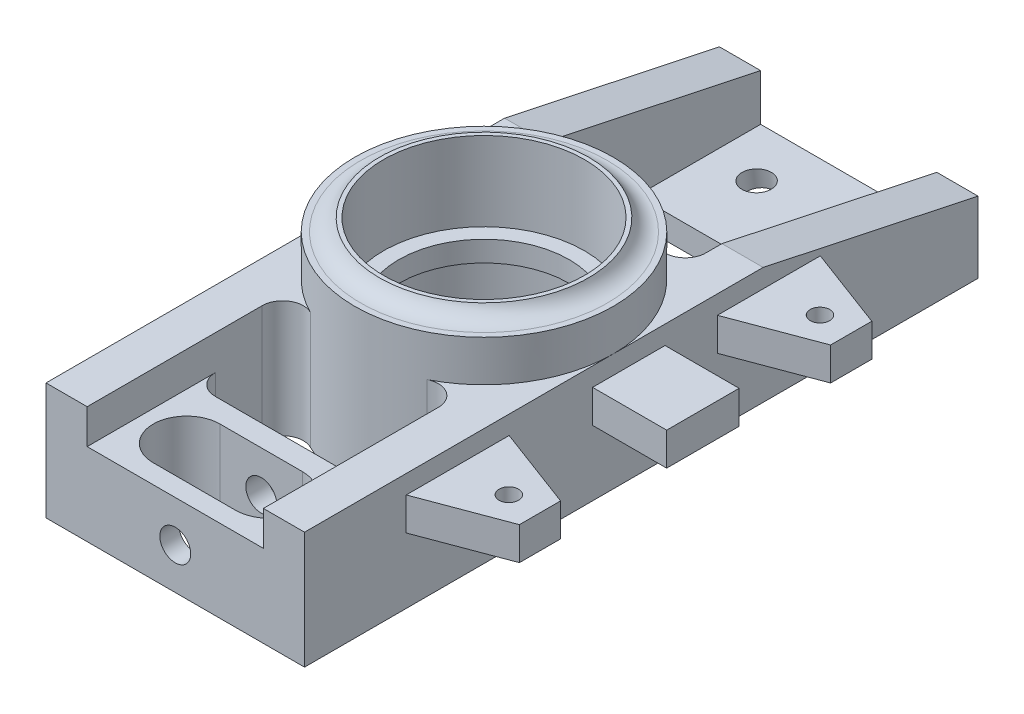
from build123d import *
from build123d.topology import SkipClean

# Parameters (mm, degrees)
HOUSING_FILLET_LIP_R               = 6.35
UBJ_START                          = 36.068
UBJ_MATERIAL_PREP_DEPTH            = 36.068
UBJ_FLAT_CAMBER_SPOT_DEPTH         = 28.448
WEIGHT_SAVING_UPPER_CUT_REACH      = 129.564
WEIGHT_SAVE_ARM_SHORT_REACH        = 149.603
UBJ_FILLET_R                       = 6.35
UBJ_HOLES_REACH                    = 137.735
UBJ_HOLE_SKETCH_R                  = 4.5
SKETCH18_R                         = 8
CUT_EXTRUDE2_DEPTH                 = 3.81
LBJ_START                          = -36.068
LBJ_MATERIAL_PREP_DEPTH            = 36.068
FLAT_LBJ_PREP_DEPTH                = 10.668
LBJ_SLOT_DEPTH                     = 25.4
LBJ_WEIGHT_AND_BOLT_CLEARING_DEPTH = 25.4
LBJ_FILLET_R                       = 6.35
LBJ_HOLE_REACH                     = 220
SKETCH14_R                         = 4.7625
BRAKE_HOLER_R                      = 3
BRAKE_CALIPER_HOLER_DEPTH          = 10.16
SKETCH16_W                         = 22.86
SKETCH16_H                         = 22.352
SPEED_SENSOR_EXTRUDE_DEPTH         = 10.16
SKETCH19_R                         = 1.27
TOE_BRAKCET_HOLES_DEPTH            = 9
THREAD1_PITCH                      = 0.79375
THREAD2_PITCH                      = 0.79375
THREAD3_PITCH                      = 0.79375


with BuildPart() as part:
    # Bearing Sketch → Bearing Revolve (revolve)
    with BuildSketch(Plane(origin=(0, 0, 0), x_dir=(0, 0, -1), z_dir=(1, 0, 0)), mode=Mode.PRIVATE) as bearing_revolve_sk:
        Polygon((-39.878, 0), (-39.878, 48.768), (-32.258, 48.768), (-32.258, 52.578), (-30.99943, 52.578), (-30.99943, 28.194), (-26.289, 28.194), (-26.289, 21.844), (-30.99943, 21.844), (-30.99943, 0), align=None)
    revolve(bearing_revolve_sk.sketch.rotate(Axis((0, 0, 0), (0, 1, 0)), 180), axis=Axis((0, 0, 0), (0, 1, 0)))

    # Housing Fillet Lip
    # the kernel refuses this fillet: 6.35 mm, written as the material it adds along each edge
    with BuildSketch(Plane(origin=(0, 48.768, 0), x_dir=(0, 0, -1), z_dir=(1, 0, 0))) as housing_fillet_lip_piece_1:
        with BuildLine():
            CenterArc((38.077871133, 6.35), HOUSING_FILLET_LIP_R, 203.578178478, 66.421821522)
            Line((32.258, 3.81), (32.141602577, 3.7592))
            ThreePointArc((32.141602577, 3.7592), (32.131, 1.905), (32.131, 0))
            Line((32.131, 0), (32.258, -0.127))
            Line((32.258, -0.127), (38.077871133, -0.127))
            Line((38.077871133, -0.127), (38.077871133, 0))
        make_face()
    revolve(axis=Axis((0, 48.768, 0), (0, 1, 0)))

    # PrepArea(WithadjWidth) → UBJ Material Prep (add)
    with BuildSketch(Plane(origin=(0, 0, 0), x_dir=(1, 0, 0), z_dir=(0, 1, 0)).offset(UBJ_START)):
        with BuildLine():
            Line((-39.878, 0), (-39.878, 112.522))
            Line((-39.878, 112.522), (39.878, 112.522))
            Line((39.878, 112.522), (39.878, 0))
            ThreePointArc((39.878, 0), (0, 39.878), (-39.878, 0))
        make_face()
    extrude(amount=-UBJ_MATERIAL_PREP_DEPTH)

    # Flat Camber Spot → UBJ Flat Camber Spot (cut)
    with SkipClean():  # the faces are left unmerged after this step: merging them gives an invalid solid
        with BuildSketch(Plane(origin=(0, 36.068, 0), x_dir=(1, 0, 0), z_dir=(0, 1, 0))):
            with BuildLine():
                Line((-27.178, 112.522), (-27.178, 29.182378244))
                ThreePointArc((-27.178, 29.182378244), (0, 39.878), (27.178, 29.182378244))
                Line((27.178, 29.182378244), (27.178, 112.522))
                Line((27.178, 112.522), (-27.178, 112.522))
            make_face()
        extrude(amount=-UBJ_FLAT_CAMBER_SPOT_DEPTH, mode=Mode.SUBTRACT)
    add(part.part.scale(1), mode=Mode.REPLACE)  # the faces are merged on a copy

    # WeightUpper Cut → Weight Saving Upper Cut (cut, up to next)
    with BuildSketch(Plane(origin=(0, 7.62, 0), x_dir=(1, 0, 0), z_dir=(0, 1, 0)), mode=Mode.PRIVATE) as weight_saving_upper_cut_sk1:
        with BuildLine():
            Line((-27.178, 74.422), (27.178, 74.422))
            Line((27.178, 74.422), (27.178, 29.182378244))
            ThreePointArc((27.178, 29.182378244), (0, 39.878), (-27.178, 29.182378244))
            Line((-27.178, 29.182378244), (-27.178, 74.422))
        make_face()
    weight_saving_upper_cut_tool1 = extrude(weight_saving_upper_cut_sk1.sketch, amount=-WEIGHT_SAVING_UPPER_CUT_REACH, mode=Mode.PRIVATE) & part.part
    add(weight_saving_upper_cut_tool1.solids().sort_by_distance((0, 7.62, -55.347878))[0], mode=Mode.SUBTRACT)

    # Weight Save Arm Short: up to this face of the body (flat: up to its plane)
    weight_save_arm_short_end = Plane(part.part.faces().sort_by_distance((39.878, 18.034, -56.261))[0])
    # Sketch8 → Weight Save Arm Short (cut, up to the picked face)
    with BuildSketch(Plane.ZY.offset(39.878), mode=Mode.PRIVATE) as weight_save_arm_short_sk1:
        Polygon((-112.522, 21.976775301), (-46.228, 36.068), (-112.522, 36.068), align=None)
    weight_save_arm_short_tool1 = split(extrude(weight_save_arm_short_sk1.sketch, amount=-WEIGHT_SAVE_ARM_SHORT_REACH, mode=Mode.PRIVATE), bisect_by=weight_save_arm_short_end, keep=Keep.BOTH, mode=Mode.PRIVATE)
    add(weight_save_arm_short_tool1.solids().sort_by(Axis((-39.878, 31.370925, -90.424), (1, 0, 0)))[0], mode=Mode.SUBTRACT)

    # UBJ Fillet
    # the kernel refuses this fillet: 6.35 mm, written as the material it adds along each edge
    with BuildSketch(Plane(origin=(27.178, 36.068, -29.182378244), x_dir=(-0.8204405839916293, 0, -0.5717317973835933), z_dir=(0, -1, 0))) as ubj_fillet_piece_1:
        with BuildLine():
            CenterArc((12.120741225, 6.286772968), UBJ_FILLET_R, 145.128922247, 116.778941593)
            Line((6.910943516, 9.917269881), (0, 0))
            ThreePointArc((0, 0), (5.613440626, 0.397065762), (11.226881252, 0))
        make_face()
    extrude(amount=28.448)
    with BuildSketch(Plane(origin=(-27.178, 36.068, -29.182378244), x_dir=(0.8204405839916296, 0, -0.5717317973835931), z_dir=(0, -1, 0))) as ubj_fillet_piece_2:
        with BuildLine():
            CenterArc((12.120741225, -6.286772968), UBJ_FILLET_R, 98.09213616, 116.778941593)
            Line((6.910943516, -9.917269881), (0, 0))
            ThreePointArc((0, 0), (5.613440626, -0.397065762), (11.226881252, 0))
        make_face()
    extrude(amount=28.448)
    with BuildSketch(Plane(origin=(-27.178, 7.62, -74.422), x_dir=(0, 0, 1), z_dir=(0, -1, 0)), Plane(origin=(27.178, 7.62, -74.422), x_dir=(-1, 0, 0), z_dir=(0, -1, 0))) as ubj_fillet_piece_3:
        with BuildLine():
            CenterArc((UBJ_FILLET_R, -UBJ_FILLET_R), UBJ_FILLET_R, 90, 90)
            Line((0, -UBJ_FILLET_R), (0, 0))
            Line((0, 0), (UBJ_FILLET_R, 0))
        make_face()
    extrude(amount=7.62)
    with BuildSketch(Plane(origin=(-27.178, 7.62, -29.182378244), x_dir=(0.8204405839916296, 0, -0.5717317973835931), z_dir=(0, -1, 0))) as ubj_fillet_piece_4:
        with BuildLine():
            CenterArc((12.120741225, -6.286772968), UBJ_FILLET_R, 98.09213616, 116.778941593)
            Line((6.910943516, -9.917269881), (0, 0))
            ThreePointArc((0, 0), (5.613440626, -0.397065762), (11.226881252, 0))
        make_face()
    extrude(amount=7.62)
    with BuildSketch(Plane(origin=(27.178, 7.62, -29.182378244), x_dir=(-0.8204405839916293, 0, -0.5717317973835934), z_dir=(0, -1, 0))) as ubj_fillet_piece_5:
        with BuildLine():
            CenterArc((12.120741225, 6.286772968), UBJ_FILLET_R, 145.128922247, 116.778941593)
            Line((6.910943516, 9.917269881), (0, 0))
            ThreePointArc((0, 0), (5.613440626, 0.397065762), (11.226881252, 0))
        make_face()
    extrude(amount=7.62)

    # UBJ Holes: up to this plane
    ubj_holes_end = Plane(origin=(0, 7.62, 30.99943), z_dir=(0, 1, 0))
    # UBJ Hole Sketch → UBJ Holes (cut, up to the surface)
    with BuildSketch(Plane(origin=(0, -15.81854211, -2.269576176), x_dir=(-1, 0, 0), z_dir=(0, -0.9898635935888408, -0.1420213578564376)), mode=Mode.PRIVATE) as ubj_holes_sk1:
        with Locations(Location((-12.7, 96.903431278, 0), (0, 0, 90))):
            Circle(UBJ_HOLE_SKETCH_R)
    ubj_holes_tool1 = split(extrude(ubj_holes_sk1.sketch, amount=-UBJ_HOLES_REACH, mode=Mode.PRIVATE), bisect_by=ubj_holes_end, keep=Keep.BOTH, mode=Mode.PRIVATE)
    add(ubj_holes_tool1.solids().sort_by_distance((12.7, -2.056185, -98.190755))[0], mode=Mode.SUBTRACT)
    # UBJ Hole Sketch → UBJ Holes (cut, up to the surface)
    with BuildSketch(Plane(origin=(0, -15.81854211, -2.269576176), x_dir=(-1, 0, 0), z_dir=(0, -0.9898635935888408, -0.1420213578564376)), mode=Mode.PRIVATE) as ubj_holes_sk2:
        with Locations(Location((12.7, 96.903431278, 0), (0, 0, 90))):
            Circle(UBJ_HOLE_SKETCH_R)
    ubj_holes_tool2 = split(extrude(ubj_holes_sk2.sketch, amount=-UBJ_HOLES_REACH, mode=Mode.PRIVATE), bisect_by=ubj_holes_end, keep=Keep.BOTH, mode=Mode.PRIVATE)
    add(ubj_holes_tool2.solids().sort_by_distance((-12.7, -2.056185, -98.190755))[0], mode=Mode.SUBTRACT)

    # Sketch18 → Cut-Extrude2 (cut)
    with BuildSketch(Plane(origin=(0, -15.81854211, -2.269576176), x_dir=(-1, 0, 0), z_dir=(0, -0.9898635935888408, -0.1420213578564376))):
        with Locations(Location((-12.7, 96.903431278, 0), (0, 0, 90))):
            Circle(SKETCH18_R)
        with Locations(Location((12.7, 96.903431278, 0), (0, 0, 90))):
            Circle(SKETCH18_R)
    extrude(amount=-CUT_EXTRUDE2_DEPTH, mode=Mode.SUBTRACT)

    # Sketch9 → LBJ Material Prep (add)
    with BuildSketch(Plane.XZ.offset(LBJ_START)):
        with BuildLine():
            Line((-39.878, 0), (-39.878, 95.25))
            Line((-39.878, 95.25), (39.878, 95.25))
            Line((39.878, 95.25), (39.878, 0))
            ThreePointArc((39.878, 0), (0, 39.878), (-39.878, 0))
        make_face()
    extrude(amount=LBJ_MATERIAL_PREP_DEPTH)

    # Sketch10 → Flat LBJ Prep (cut)
    with SkipClean():  # the faces are left unmerged after this step: merging them gives an invalid solid
        with BuildSketch(Plane(origin=(0, 36.068, 0), x_dir=(1, 0, 0), z_dir=(0, 1, 0))):
            with BuildLine():
                Line((-27.178, -29.182378244), (-27.178, -95.25))
                Line((-27.178, -95.25), (27.178, -95.25))
                Line((27.178, -95.25), (27.178, -29.182378244))
                ThreePointArc((27.178, -29.182378244), (0, -39.878), (-27.178, -29.182378244))
            make_face()
        extrude(amount=-FLAT_LBJ_PREP_DEPTH, mode=Mode.SUBTRACT)

    # Sketch12 → LBJ Slot (cut)
    with SkipClean():  # the faces are left unmerged after this step: merging them gives an invalid solid
        with BuildSketch(Plane(origin=(0, 25.4, 0), x_dir=(1, 0, 0), z_dir=(0, 1, 0))):
            with BuildLine():
                Line((-12.7, -68.717839434), (12.7, -68.717839434))
                ThreePointArc((12.7, -68.717839434), (23.0251, -79.042939434), (12.7, -89.368039434))
                Line((12.7, -89.368039434), (-12.7, -89.368039434))
                ThreePointArc((-12.7, -89.368039434), (-23.0251, -79.042939434), (-12.7, -68.717839434))
            make_face()
        extrude(amount=-LBJ_SLOT_DEPTH, mode=Mode.SUBTRACT)

    # Sketch13 → LBJ Weight and Bolt Clearing (cut)
    with SkipClean():  # the faces are left unmerged after this step: merging them gives an invalid solid
        with BuildSketch(Plane(origin=(0, 25.4, 0), x_dir=(1, 0, 0), z_dir=(0, 1, 0))):
            with BuildLine():
                Line((-27.178, -29.182378244), (-27.178, -62.075739434))
                Line((-27.178, -62.075739434), (27.178, -62.075739434))
                Line((27.178, -62.075739434), (27.178, -29.182378244))
                ThreePointArc((27.178, -29.182378244), (0, -39.878), (-27.178, -29.182378244))
            make_face()
        extrude(amount=-LBJ_WEIGHT_AND_BOLT_CLEARING_DEPTH, mode=Mode.SUBTRACT)

    # LBJ Fillet
    # the kernel refuses this fillet: 6.35 mm, written as the material it adds along each edge
    with BuildSketch(Plane(origin=(-27.178, 25.4, 29.182378244), x_dir=(0.8204405839916299, 0, 0.5717317973835926), z_dir=(0, -1, 0))) as lbj_fillet_piece_1:
        with BuildLine():
            CenterArc((12.120741225, 6.286772968), LBJ_FILLET_R, 145.128922247, 116.778941593)
            Line((6.910943516, 9.917269881), (0, 0))
            ThreePointArc((0, 0), (5.613440626, 0.397065762), (11.226881252, 0))
        make_face()
    extrude(amount=25.4)
    with BuildSketch(Plane(origin=(27.178, 25.4, 29.182378244), x_dir=(-0.8204405839916303, 0, 0.5717317973835919), z_dir=(0, -1, 0))) as lbj_fillet_piece_2:
        with BuildLine():
            CenterArc((12.120741225, -6.286772968), LBJ_FILLET_R, 98.09213616, 116.778941593)
            Line((6.910943516, -9.917269881), (0, 0))
            ThreePointArc((0, 0), (5.613440626, -0.397065762), (11.226881252, 0))
        make_face()
    extrude(amount=25.4)
    with BuildSketch(Plane(origin=(27.178, 25.4, 62.075739434), x_dir=(-1, 0, 0), z_dir=(0, -1, 0)), Plane(origin=(-27.178, 25.4, 62.075739434), x_dir=(0, 0, -1), z_dir=(0, -1, 0))) as lbj_fillet_piece_3:
        with BuildLine():
            CenterArc((LBJ_FILLET_R, LBJ_FILLET_R), LBJ_FILLET_R, 180, 90)
            Line((0, LBJ_FILLET_R), (0, 0))
            Line((0, 0), (LBJ_FILLET_R, 0))
        make_face()
    extrude(amount=25.4)
    with BuildSketch(Plane(origin=(27.178, 36.068, 29.182378244), x_dir=(-0.8204405839916302, 0, 0.571731797383592), z_dir=(0, -1, 0))) as lbj_fillet_piece_4:
        with BuildLine():
            CenterArc((12.120741225, -6.286772968), LBJ_FILLET_R, 98.09213616, 116.778941593)
            Line((6.910943516, -9.917269881), (0, 0))
            ThreePointArc((0, 0), (5.613440626, -0.397065762), (11.226881252, 0))
        make_face()
    extrude(amount=10.668)
    with BuildSketch(Plane(origin=(-27.178, 36.068, 29.182378244), x_dir=(0.8204405839916299, 0, 0.5717317973835926), z_dir=(0, -1, 0))) as lbj_fillet_piece_5:
        with BuildLine():
            CenterArc((12.120741225, 6.286772968), LBJ_FILLET_R, 145.128922247, 116.778941593)
            Line((6.910943516, 9.917269881), (0, 0))
            ThreePointArc((0, 0), (5.613440626, 0.397065762), (11.226881252, 0))
        make_face()
    extrude(amount=10.668)

    # LBJ Hole: up to this face of the body (flat: up to its plane)
    lbj_hole_end = Plane(part.part.faces().sort_by_distance((0, 12.7, 62.075739434))[0])
    # Sketch14 → LBJ Hole (cut, up to the picked face)
    with BuildSketch(Plane.XY.offset(95.25), mode=Mode.PRIVATE) as lbj_hole_sk1:
        with Locations((0, 12.7)):
            Circle(SKETCH14_R)
    lbj_hole_tool1 = split(extrude(lbj_hole_sk1.sketch, amount=-LBJ_HOLE_REACH, mode=Mode.PRIVATE), bisect_by=lbj_hole_end, keep=Keep.BOTH, mode=Mode.PRIVATE)
    add(lbj_hole_tool1.solids().sort_by(Axis((0, 12.7, 95.25), (0, 0, -1)))[0], mode=Mode.SUBTRACT)

    # Brake Holer → Brake Caliper Holer (add)
    # profile 1 of 2: a face of its own
    with BuildSketch(Plane(origin=(0, 20.17, 0), x_dir=(-1, 0, 0), z_dir=(0, -1, 0))):
        Polygon((-39.878, -32.125), (-65.278, -41.65), (-65.278, -54.35), (-39.878, -63.875), align=None)
        with Locations(Location((-55.6468, -48, 0), (0, 0, 90))):
            Circle(BRAKE_HOLER_R, mode=Mode.SUBTRACT)
    # profile 2 of 2: a face of its own
    with BuildSketch(Plane(origin=(0, 20.17, 0), x_dir=(-1, 0, 0), z_dir=(0, -1, 0))):
        Polygon((-39.878, 32.125), (-39.878, 63.875), (-65.278, 54.35), (-65.278, 41.65), align=None)
        with Locations(Location((-55.6468, 48, 0), (0, 0, 90))):
            Circle(BRAKE_HOLER_R, mode=Mode.SUBTRACT)
    extrude(amount=-BRAKE_CALIPER_HOLER_DEPTH)

    # Sketch16 → Speed Sensor Extrude (add)
    with BuildSketch(Plane(origin=(0, 20.17, 0), x_dir=(-1, 0, 0), z_dir=(0, -1, 0))):
        with Locations((-51.308, 4.791359774)):
            Rectangle(SKETCH16_W, SKETCH16_H)
    extrude(amount=-SPEED_SENSOR_EXTRUDE_DEPTH)

    # Sketch19 → Toe Brakcet Holes (cut)
    with BuildSketch(Plane.ZY.offset(39.878)):
        with Locations((31.2928, 26.67)):
            Circle(SKETCH19_R)
        with Locations((31.2928, 9.525)):
            Circle(SKETCH19_R)
        with Locations((55.1053, 9.525)):
            Circle(SKETCH19_R)
    extrude(amount=-TOE_BRAKCET_HOLES_DEPTH, mode=Mode.SUBTRACT)

    # Thread1: the profile of Thread Profile1 profile screwed along a right-hand helix of 12.598425 turns, 8 arcs to a turn; built about Z, then put on its axis
    with SkipClean():  # the faces are left unmerged after this step: merging them gives an invalid solid
        thread1_z = Axis((0, 0, 0), (0, 0, 1))
        thread1_corners = [(1.2697, 0, -0.000173205), (1.699629788, 0, 0.248046874), (1.699629788, 0, 0.347265624), (1.2697, 0, 0.595485703)]
        with BuildLine(mode=Mode.PRIVATE) as thread1_profile:
            Line(thread1_corners[0], thread1_corners[1])
            Line(thread1_corners[1], thread1_corners[2])
            Line(thread1_corners[2], thread1_corners[3])
            Line(thread1_corners[3], thread1_corners[0])
        thread1_cap = Face(thread1_profile.wire())
        thread1_turn_angles = [0, 22.5, 45, 67.5, 90, 112.5, 135, 157.5, 180, 202.5, 225, 247.5, 270, 292.5, 315, 337.5, 360]
        thread1_turn_weights = [1, 0.9238795325112867, 1, 0.9238795325112867, 1, 0.9238795325112867, 1, 0.9238795325112867, 1, 0.9238795325112867, 1, 0.9238795325112867, 1, 0.9238795325112867, 1, 0.9238795325112867, 1]
        thread1_turn_rails = [Edge.make_bspline([Vector(p[0], p[1], 0).rotate(thread1_z, thread1_turn_angles[k]) / thread1_turn_weights[k] + Vector(0, 0, p[2] + THREAD1_PITCH * thread1_turn_angles[k] / 360) for k in range(17)], [0, 0, 0, 1, 1, 2, 2, 3, 3, 4, 4, 5, 5, 6, 6, 7, 7, 8, 8, 8], 2, thread1_turn_weights) for p in thread1_corners]
        thread1_turn_sides = [Face.make_surface_from_curves(thread1_turn_rails[p[0]], thread1_turn_rails[p[1]]) for p in [(0, 1), (1, 2), (2, 3), (3, 0)]]
        thread1_last_angles = [4320, 4342.5, 4365, 4387.5, 4410, 4432.5, 4455, 4477.5, 4500, 4517.716535433, 4535.433070866]
        thread1_last_weights = [1, 0.9238795325112867, 1, 0.9238795325112867, 1, 0.9238795325112867, 1, 0.9238795325112867, 1, 0.9525736983244454, 1]
        thread1_last_rails = [Edge.make_bspline([Vector(p[0], p[1], 0).rotate(thread1_z, thread1_last_angles[k]) / thread1_last_weights[k] + Vector(0, 0, p[2] + THREAD1_PITCH * thread1_last_angles[k] / 360) for k in range(11)], [0, 0, 0, 1, 1, 2, 2, 3, 3, 4, 4, 5, 5, 5], 2, thread1_last_weights) for p in thread1_corners]
        thread1_last_sides = [Face.make_surface_from_curves(thread1_last_rails[p[0]], thread1_last_rails[p[1]]) for p in [(0, 1), (1, 2), (2, 3), (3, 0)]]
        thread1 = Plane(origin=(-39.878, 26.67, 31.2928), x_dir=(0, 0, -1), z_dir=(1, 0, 0)) * Solid(Shell([*[p.moved(Location((0, 0, THREAD1_PITCH * i))) for i in range(12) for p in thread1_turn_sides], *thread1_last_sides, thread1_cap, thread1_cap.rotate(thread1_z, 4535.433070866).moved(Location((0, 0, THREAD1_PITCH * 4535.433070866 / 360)))]))
        add(thread1, mode=Mode.SUBTRACT)

    # Thread2: the profile of Thread Profile2 profile screwed along a right-hand helix of 12.598425 turns, 8 arcs to a turn; built about Z, then put on its axis
    with SkipClean():  # the faces are left unmerged after this step: merging them gives an invalid solid
        thread2_z = Axis((0, 0, 0), (0, 0, 1))
        thread2_corners = [(1.2697, 0, -0.000173205), (1.699629788, 0, 0.248046874), (1.699629788, 0, 0.347265624), (1.2697, 0, 0.595485703)]
        with BuildLine(mode=Mode.PRIVATE) as thread2_profile:
            Line(thread2_corners[0], thread2_corners[1])
            Line(thread2_corners[1], thread2_corners[2])
            Line(thread2_corners[2], thread2_corners[3])
            Line(thread2_corners[3], thread2_corners[0])
        thread2_cap = Face(thread2_profile.wire())
        thread2_turn_angles = [0, 22.5, 45, 67.5, 90, 112.5, 135, 157.5, 180, 202.5, 225, 247.5, 270, 292.5, 315, 337.5, 360]
        thread2_turn_weights = [1, 0.9238795325112867, 1, 0.9238795325112867, 1, 0.9238795325112867, 1, 0.9238795325112867, 1, 0.9238795325112867, 1, 0.9238795325112867, 1, 0.9238795325112867, 1, 0.9238795325112867, 1]
        thread2_turn_rails = [Edge.make_bspline([Vector(p[0], p[1], 0).rotate(thread2_z, thread2_turn_angles[k]) / thread2_turn_weights[k] + Vector(0, 0, p[2] + THREAD2_PITCH * thread2_turn_angles[k] / 360) for k in range(17)], [0, 0, 0, 1, 1, 2, 2, 3, 3, 4, 4, 5, 5, 6, 6, 7, 7, 8, 8, 8], 2, thread2_turn_weights) for p in thread2_corners]
        thread2_turn_sides = [Face.make_surface_from_curves(thread2_turn_rails[p[0]], thread2_turn_rails[p[1]]) for p in [(0, 1), (1, 2), (2, 3), (3, 0)]]
        thread2_last_angles = [4320, 4342.5, 4365, 4387.5, 4410, 4432.5, 4455, 4477.5, 4500, 4517.716535433, 4535.433070866]
        thread2_last_weights = [1, 0.9238795325112867, 1, 0.9238795325112867, 1, 0.9238795325112867, 1, 0.9238795325112867, 1, 0.9525736983244454, 1]
        thread2_last_rails = [Edge.make_bspline([Vector(p[0], p[1], 0).rotate(thread2_z, thread2_last_angles[k]) / thread2_last_weights[k] + Vector(0, 0, p[2] + THREAD2_PITCH * thread2_last_angles[k] / 360) for k in range(11)], [0, 0, 0, 1, 1, 2, 2, 3, 3, 4, 4, 5, 5, 5], 2, thread2_last_weights) for p in thread2_corners]
        thread2_last_sides = [Face.make_surface_from_curves(thread2_last_rails[p[0]], thread2_last_rails[p[1]]) for p in [(0, 1), (1, 2), (2, 3), (3, 0)]]
        thread2 = Plane(origin=(-39.878, 9.525, 31.2928), x_dir=(0, 0, -1), z_dir=(1, 0, 0)) * Solid(Shell([*[p.moved(Location((0, 0, THREAD2_PITCH * i))) for i in range(12) for p in thread2_turn_sides], *thread2_last_sides, thread2_cap, thread2_cap.rotate(thread2_z, 4535.433070866).moved(Location((0, 0, THREAD2_PITCH * 4535.433070866 / 360)))]))
        add(thread2, mode=Mode.SUBTRACT)

    # Thread3: the profile of Thread Profile3 profile screwed along a right-hand helix of 12.598425 turns, 8 arcs to a turn; built about Z, then put on its axis
    with SkipClean():  # the faces are left unmerged after this step: merging them gives an invalid solid
        thread3_z = Axis((0, 0, 0), (0, 0, 1))
        thread3_corners = [(1.2697, 0, -0.000173205), (1.699629788, 0, 0.248046874), (1.699629788, 0, 0.347265624), (1.2697, 0, 0.595485703)]
        with BuildLine(mode=Mode.PRIVATE) as thread3_profile:
            Line(thread3_corners[0], thread3_corners[1])
            Line(thread3_corners[1], thread3_corners[2])
            Line(thread3_corners[2], thread3_corners[3])
            Line(thread3_corners[3], thread3_corners[0])
        thread3_cap = Face(thread3_profile.wire())
        thread3_turn_angles = [0, 22.5, 45, 67.5, 90, 112.5, 135, 157.5, 180, 202.5, 225, 247.5, 270, 292.5, 315, 337.5, 360]
        thread3_turn_weights = [1, 0.9238795325112867, 1, 0.9238795325112867, 1, 0.9238795325112867, 1, 0.9238795325112867, 1, 0.9238795325112867, 1, 0.9238795325112867, 1, 0.9238795325112867, 1, 0.9238795325112867, 1]
        thread3_turn_rails = [Edge.make_bspline([Vector(p[0], p[1], 0).rotate(thread3_z, thread3_turn_angles[k]) / thread3_turn_weights[k] + Vector(0, 0, p[2] + THREAD3_PITCH * thread3_turn_angles[k] / 360) for k in range(17)], [0, 0, 0, 1, 1, 2, 2, 3, 3, 4, 4, 5, 5, 6, 6, 7, 7, 8, 8, 8], 2, thread3_turn_weights) for p in thread3_corners]
        thread3_turn_sides = [Face.make_surface_from_curves(thread3_turn_rails[p[0]], thread3_turn_rails[p[1]]) for p in [(0, 1), (1, 2), (2, 3), (3, 0)]]
        thread3_last_angles = [4320, 4342.5, 4365, 4387.5, 4410, 4432.5, 4455, 4477.5, 4500, 4517.716535433, 4535.433070866]
        thread3_last_weights = [1, 0.9238795325112867, 1, 0.9238795325112867, 1, 0.9238795325112867, 1, 0.9238795325112867, 1, 0.9525736983244454, 1]
        thread3_last_rails = [Edge.make_bspline([Vector(p[0], p[1], 0).rotate(thread3_z, thread3_last_angles[k]) / thread3_last_weights[k] + Vector(0, 0, p[2] + THREAD3_PITCH * thread3_last_angles[k] / 360) for k in range(11)], [0, 0, 0, 1, 1, 2, 2, 3, 3, 4, 4, 5, 5, 5], 2, thread3_last_weights) for p in thread3_corners]
        thread3_last_sides = [Face.make_surface_from_curves(thread3_last_rails[p[0]], thread3_last_rails[p[1]]) for p in [(0, 1), (1, 2), (2, 3), (3, 0)]]
        thread3 = Plane(origin=(-39.878, 9.525, 55.1053), x_dir=(0, 0, -1), z_dir=(1, 0, 0)) * Solid(Shell([*[p.moved(Location((0, 0, THREAD3_PITCH * i))) for i in range(12) for p in thread3_turn_sides], *thread3_last_sides, thread3_cap, thread3_cap.rotate(thread3_z, 4535.433070866).moved(Location((0, 0, THREAD3_PITCH * 4535.433070866 / 360)))]))
        add(thread3, mode=Mode.SUBTRACT)


solid = part.part
